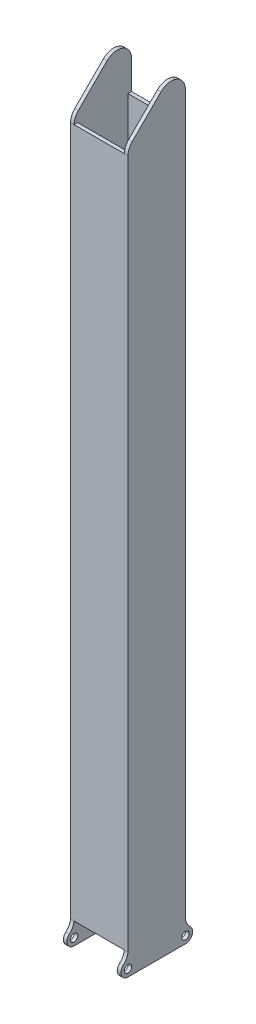
from build123d import *

# Parameters (mm, degrees)
SKETCH1_W             = 25.4
SKETCH1_H             = 25.4
SKETCH1_W_2           = 22.225
SKETCH1_H_2           = 22.225
EXTRUDE_THIN1_DEPTH   = 152.4
BOSS_EXTRUDE1_DEPTH   = 1.5875
BOSS_EXTRUDE2_START   = 22.225
BOSS_EXTRUDE2_DEPTH   = 1.5875
F_4_CLEARANCE_HOLE1_D = 3.2639
SKETCH11_R            = 6.35
BOSS_EXTRUDE3_DEPTH   = 1.5875
BOSS_EXTRUDE4_START   = -25.4
SKETCH11_3_R          = 6.35
BOSS_EXTRUDE4_DEPTH   = 1.5875


# Read off the part's stored shape, not the designer's step: Boss-Extrude2
with BuildPart() as part:
    # Sketch1 → Extrude-Thin1 (new, symmetric)
    with BuildSketch(Plane(origin=(0, 0, 0), x_dir=(1, 0, 0), z_dir=(0, 1, 0))):
        Rectangle(SKETCH1_W, SKETCH1_H)
        Rectangle(SKETCH1_W_2, SKETCH1_H_2, mode=Mode.SUBTRACT)
    extrude(amount=EXTRUDE_THIN1_DEPTH, both=True)

    # Sketch3 → Boss-Extrude1 (add)
    with BuildSketch(Plane(origin=(-11.1125, 0, 0), x_dir=(0, 0, -1), z_dir=(1, 0, 0))):
        with BuildLine():
            ThreePointArc((12.7, -161.925), (15.669940551, -159.872532015), (14.800065103, -156.36875))
            ThreePointArc((14.800065103, -156.36875), (13.387535234, -154.576190551), (12.7, -152.4))
            Line((12.7, -152.4), (-12.7, -152.4))
            ThreePointArc((-12.7, -152.4), (-13.387535234, -154.576190551), (-14.800065103, -156.36875))
            ThreePointArc((-14.800065103, -156.36875), (-15.669940551, -159.872532015), (-12.7, -161.925))
            Line((-12.7, -161.925), (12.7, -161.925))
        make_face()
    extrude(amount=-BOSS_EXTRUDE1_DEPTH)

    # Boss-Extrude2 outline → Boss-Extrude2 (add)
    with BuildSketch(Plane(origin=(-11.1125, 0, 0), x_dir=(0, 0, -1), z_dir=(1, 0, 0)).offset(BOSS_EXTRUDE2_START)):
        with BuildLine():
            Line((-12.7, -161.925), (12.7, -161.925))
            ThreePointArc((12.7, -161.925), (15.669940551, -159.872532015), (14.800065103, -156.36875))
            ThreePointArc((14.800065103, -156.36875), (13.387535234, -154.576190551), (12.7, -152.4))
            Line((12.7, -152.4), (-12.7, -152.4))
            ThreePointArc((-12.7, -152.4), (-13.387535234, -154.576190551), (-14.800065103, -156.36875))
            ThreePointArc((-14.800065103, -156.36875), (-15.669940551, -159.872532015), (-12.7, -161.925))
        make_face()
    extrude(amount=BOSS_EXTRUDE2_DEPTH)

    # #4 Clearance Hole1 (through all)
    with Locations(Plane.ZY.offset(12.7)):
        with Locations((-12.7, -158.75), (12.7, -158.75)):
            Hole(F_4_CLEARANCE_HOLE1_D / 2)

    # Sketch11 → Boss-Extrude3 (add)
    with BuildSketch(Plane.ZY.offset(12.7)):
        with Locations((-6.35, 165.1)):
            Circle(SKETCH11_R)
        with BuildLine():
            Line((10.840128061, 156.890128061), (-1.859871939, 169.590128061))
            ThreePointArc((-1.859871939, 169.590128061), (-0.483364969, 167.530039796), (0, 165.1))
            ThreePointArc((0, 165.1), (-6.35, 158.75), (-12.7, 165.1))
            Line((-12.7, 165.1), (-12.7, 152.4))
            Line((-12.7, 152.4), (12.7, 152.4))
            ThreePointArc((12.7, 152.4), (12.216635031, 154.830039796), (10.840128061, 156.890128061))
        make_face()
    extrude(amount=-BOSS_EXTRUDE3_DEPTH)

    # Sketch11<3> → Boss-Extrude4 (add)
    with BuildSketch(Plane.ZY.offset(12.7).offset(BOSS_EXTRUDE4_START)):
        with BuildLine():
            Line((10.840128061, 156.890128061), (-1.859871939, 169.590128061))
            ThreePointArc((-1.859871939, 169.590128061), (-0.483364969, 167.530039796), (0, 165.1))
            ThreePointArc((0, 165.1), (-6.35, 158.75), (-12.7, 165.1))
            Line((-12.7, 165.1), (-12.7, 152.4))
            Line((-12.7, 152.4), (12.7, 152.4))
            ThreePointArc((12.7, 152.4), (12.216635031, 154.830039796), (10.840128061, 156.890128061))
        make_face()
        with Locations((-6.35, 165.1)):
            Circle(SKETCH11_3_R)
    extrude(amount=BOSS_EXTRUDE4_DEPTH)


solid = part.part
